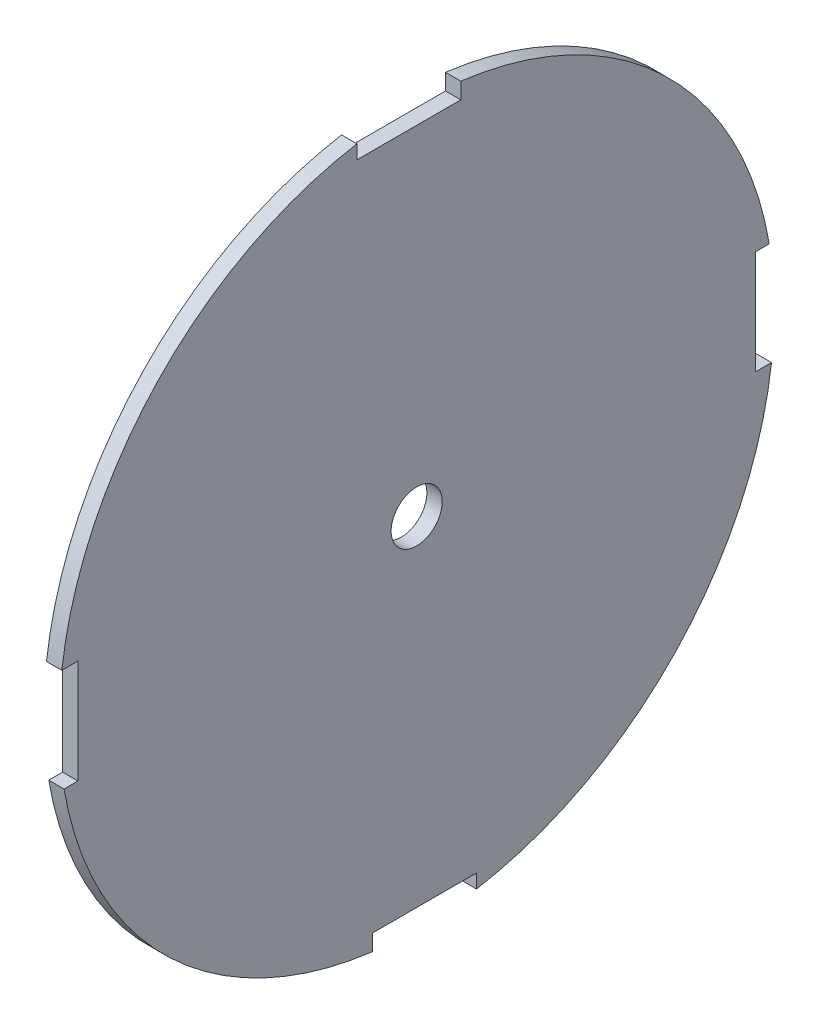
from build123d import *

# Parameters (mm, degrees)
SKETCH1_R           = 2.5
BOSS_EXTRUDE3_DEPTH = 1.5


with BuildPart() as part:
    # Sketch1 → Boss-Extrude3 (new body)
    with BuildSketch(Plane(origin=(0, 0, 0), x_dir=(0, 0, -1), z_dir=(1, 0, 0))):
        with BuildLine():
            Line((-34.73231354, 4.32046249), (-33.15, 4.32046249))
            Line((-33.15, 4.32046249), (-33.15, -5.85))
            Line((-33.15, -5.85), (-34.507644081, -5.85))
            ThreePointArc((-34.507644081, -5.85), (-24.196125182, -25.289276901), (-4.32046249, -34.73231354))
            Line((-4.32046249, -34.73231354), (-4.32046249, -33.15))
            Line((-4.32046249, -33.15), (5.85, -33.15))
            Line((5.85, -33.15), (5.85, -34.507644081))
            ThreePointArc((5.85, -34.507644081), (25.289276901, -24.196125182), (34.73231354, -4.32046249))
            Line((34.73231354, -4.32046249), (33.15, -4.32046249))
            Line((33.15, -4.32046249), (33.15, 5.85))
            Line((33.15, 5.85), (34.507644081, 5.85))
            ThreePointArc((34.507644081, 5.85), (24.196125182, 25.289276901), (4.32046249, 34.73231354))
            Line((4.32046249, 34.73231354), (4.32046249, 33.15))
            Line((4.32046249, 33.15), (-5.85, 33.15))
            Line((-5.85, 33.15), (-5.85, 34.507644081))
            ThreePointArc((-5.85, 34.507644081), (-25.289276901, 24.196125182), (-34.73231354, 4.32046249))
        make_face()
        Circle(SKETCH1_R, mode=Mode.SUBTRACT)
    extrude(amount=BOSS_EXTRUDE3_DEPTH)


solid = part.part
